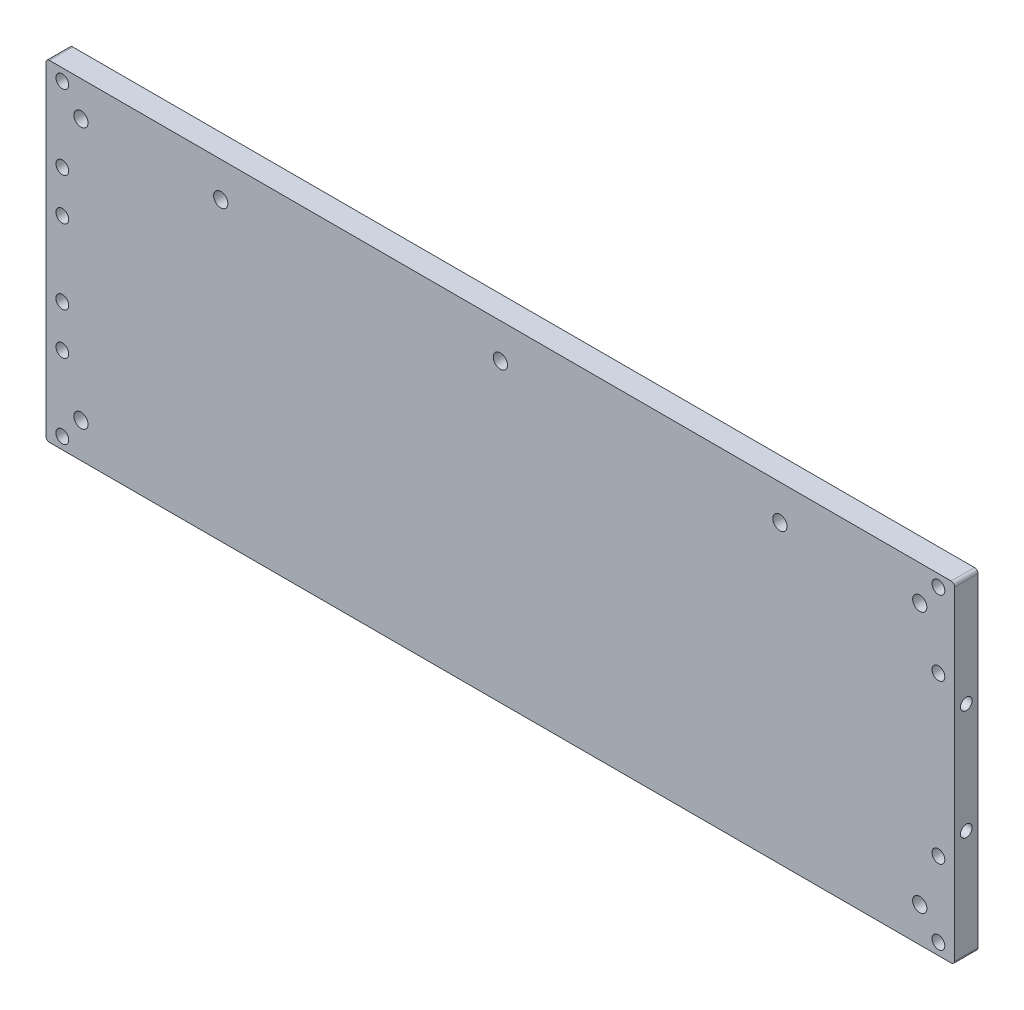
from build123d import *

# Parameters (mm, degrees)
SKETCH1_W           = 390
SKETCH1_H           = 142
BOSS_EXTRUDE1_DEPTH = 5
SKETCH2_R           = 2.75
CUT_EXTRUDE1_DEPTH  = 208.764289521
SKETCH3_R           = 3.05
CUT_EXTRUDE2_DEPTH  = 208.764289521
SKETCH5_R           = 2.5
CUT_EXTRUDE4_DEPTH  = 10
SKETCH6_R           = 2.75
CUT_EXTRUDE5_DEPTH  = 208.764289521
FILLET1_R           = 1.5


with BuildPart() as part:
    # Sketch1 → Boss-Extrude1 (new, symmetric)
    with BuildSketch(Plane.XY):
        Rectangle(SKETCH1_W, SKETCH1_H)
    extrude(amount=BOSS_EXTRUDE1_DEPTH, both=True)

    # Sketch2 → Cut-Extrude1 (cut, through all)
    with BuildSketch(Plane(origin=(0, 0, -5), x_dir=(-1, 0, 0), z_dir=(0, 0, -1))):
        with Locations((-188, 66)):
            Circle(SKETCH2_R)
        with Locations((-188, -66)):
            Circle(SKETCH2_R)
        with Locations((188, 66)):
            Circle(SKETCH2_R)
        with Locations((188, -66)):
            Circle(SKETCH2_R)
        with Locations((-188, 34)):
            Circle(SKETCH2_R)
        with Locations((-188, -34)):
            Circle(SKETCH2_R)
        with Locations((188, 34)):
            Circle(SKETCH2_R)
        with Locations((188, -34)):
            Circle(SKETCH2_R)
    extrude(amount=-CUT_EXTRUDE1_DEPTH, mode=Mode.SUBTRACT)

    # Sketch3 → Cut-Extrude2 (cut, through all)
    with BuildSketch(Plane.XY.offset(5)):
        with Locations((-180, 56)):
            Circle(SKETCH3_R)
        with Locations((180, 56)):
            Circle(SKETCH3_R)
        with Locations((180, -56)):
            Circle(SKETCH3_R)
        with Locations((-180, -56)):
            Circle(SKETCH3_R)
        with Locations((0, 56)):
            Circle(SKETCH3_R)
        with Locations((-120, 56)):
            Circle(SKETCH3_R)
        with Locations((120, 56)):
            Circle(SKETCH3_R)
    extrude(amount=-CUT_EXTRUDE2_DEPTH, mode=Mode.SUBTRACT)

    # Sketch5 → Cut-Extrude4 (cut)
    with BuildSketch(Plane(origin=(195, 0, 0), x_dir=(0, 0, -1), z_dir=(1, 0, 0))):
        with Locations((0, 23.6)):
            Circle(SKETCH5_R)
        with Locations((0, -23.6)):
            Circle(SKETCH5_R)
    extrude(amount=-CUT_EXTRUDE4_DEPTH, mode=Mode.SUBTRACT)

    # Sketch6 → Cut-Extrude5 (cut, through all)
    with BuildSketch(Plane.XY.offset(5)):
        with Locations((-188, 16)):
            Circle(SKETCH6_R)
        with Locations((-188, -16)):
            Circle(SKETCH6_R)
    extrude(amount=-CUT_EXTRUDE5_DEPTH, mode=Mode.SUBTRACT)

    # Fillet1
    fillet1_edges = [part.edges().sort_by_distance(p)[0] for p in [
        (-195, -71, 0),
        (195, -71, 0),
        (195, 71, 0),
        (-195, 71, 0),
    ]]
    fillet(fillet1_edges, radius=FILLET1_R)


solid = part.part
